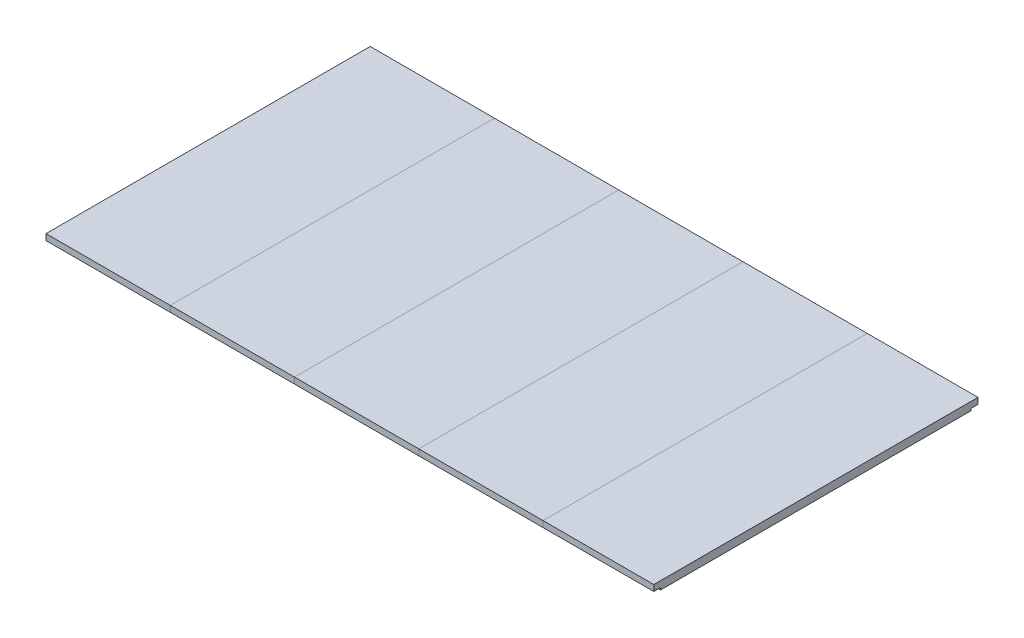
from build123d import *

# Parameters (mm, degrees)
SKETCH1_W           = 1428.75
SKETCH1_H           = 762
BOSS_EXTRUDE1_DEPTH = 19.05
SKETCH3_W           = 15.875
SKETCH3_H           = 4.7625
CUT_EXTRUDE1_DEPTH  = 1479.800346565
SPLIT1_START        = 454.025
SPLIT1_DEPTH        = 260.35
SPLIT1_START_2      = -714.375
SPLIT1_2_DEPTH      = 292.1
SPLIT1_START_3      = -422.275
SPLIT1_3_DEPTH      = 292.1
SPLIT1_4_DEPTH      = 584.2
SPLIT1_START_4      = 161.925
SPLIT1_5_DEPTH      = 552.45
SPLIT1_6_DEPTH      = 292.1


# Read off the part's stored shape, not the designer's step: Split1
with BuildPart() as part:
    # Sketch1 → Boss-Extrude1 (new body)
    with BuildSketch(Plane(origin=(0, 0, 0), x_dir=(1, 0, 0), z_dir=(0, 1, 0))):
        Rectangle(SKETCH1_W, SKETCH1_H)
    extrude(amount=BOSS_EXTRUDE1_DEPTH)

    # Sketch3 → Cut-Extrude1 (cut, through all)
    with BuildSketch(Plane.ZY.offset(714.375)):
        with Locations((-373.0625, 2.38125)):
            Rectangle(SKETCH3_W, SKETCH3_H)
        with Locations((373.0625, 2.38125)):
            Rectangle(SKETCH3_W, SKETCH3_H)
    extrude(amount=-CUT_EXTRUDE1_DEPTH, mode=Mode.SUBTRACT)

    # Split1 4 outline → Split1 4 (cut)
    with BuildSketch(Plane.YZ.offset(SPLIT1_START_2)):
        Polygon((4.7625, -381), (19.05, -381), (19.05, 381), (4.7625, 381), (4.7625, 365.125), (0, 365.125), (0, -365.125), (4.7625, -365.125), align=None)
    extrude(amount=SPLIT1_4_DEPTH, mode=Mode.SUBTRACT)

    # Split1 5 outline → Split1 5 (cut)
    with BuildSketch(Plane.YZ.offset(SPLIT1_START_4)):
        Polygon((4.7625, -381), (19.05, -381), (19.05, 381), (4.7625, 381), (4.7625, 365.125), (0, 365.125), (0, -365.125), (4.7625, -365.125), align=None)
    extrude(amount=SPLIT1_5_DEPTH, mode=Mode.SUBTRACT)


with BuildPart() as body_2:
    # Split1 outline → Split1 (new body)
    with BuildSketch(Plane.YZ.offset(SPLIT1_START)):
        Polygon((19.05, 381), (4.7625, 381), (4.7625, 365.125), (0, 365.125), (0, -365.125), (4.7625, -365.125), (4.7625, -381), (19.05, -381), align=None)
    extrude(amount=SPLIT1_DEPTH)


with BuildPart() as body_3:
    # Split1 2 outline → Split1 2 (new body)
    with BuildSketch(Plane.YZ.offset(SPLIT1_START_2)):
        Polygon((4.7625, -381), (19.05, -381), (19.05, 381), (4.7625, 381), (4.7625, 365.125), (0, 365.125), (0, -365.125), (4.7625, -365.125), align=None)
    extrude(amount=SPLIT1_2_DEPTH)


with BuildPart() as body_4:
    # Split1 3 outline → Split1 3 (new body)
    with BuildSketch(Plane.YZ.offset(SPLIT1_START_3)):
        Polygon((4.7625, -381), (19.05, -381), (19.05, 381), (4.7625, 381), (4.7625, 365.125), (0, 365.125), (0, -365.125), (4.7625, -365.125), align=None)
    extrude(amount=SPLIT1_3_DEPTH)


with BuildPart() as body_5:
    # Split1 6 outline → Split1 6 (new body)
    with BuildSketch(Plane.YZ.offset(SPLIT1_START_4)):
        Polygon((4.7625, -381), (19.05, -381), (19.05, 381), (4.7625, 381), (4.7625, 365.125), (0, 365.125), (0, -365.125), (4.7625, -365.125), align=None)
    extrude(amount=SPLIT1_6_DEPTH)


solid = Compound([part.part, body_2.part, body_3.part, body_4.part, body_5.part])
